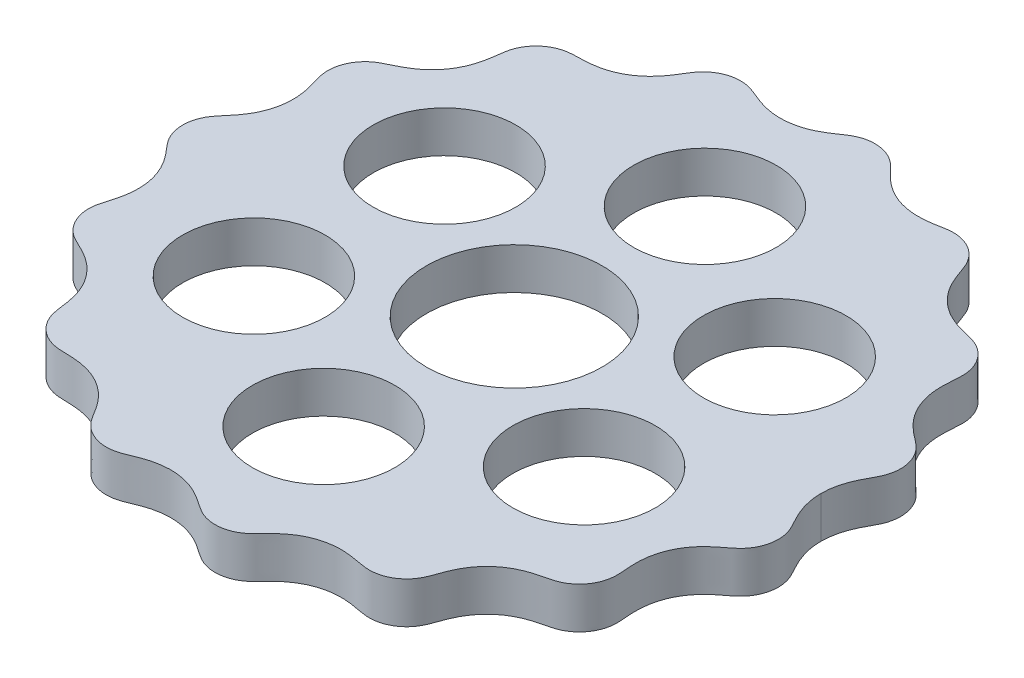
from build123d import *

# Parameters (mm, degrees)
SKETCH1_R           = 10.6
SKETCH1_R_2         = 8.6
BOSS_EXTRUDE1_DEPTH = 5


with BuildPart() as part:
    # Sketch1 → Boss-Extrude1 (new body)
    with BuildSketch(Plane(origin=(0, 0, 0), x_dir=(1, 0, 0), z_dir=(0, 1, 0))):
        with BuildLine():
            add(Edge.make_bspline(
                [(37, 0), (37, -0.03143727), (37.000453604, -0.094999987), (37.002494823, -0.209960319), (37.007935699, -0.365962041), (37.018130067, -0.547435978), (37.035778539, -0.762613663), (37.062295011, -1.000704503), (37.099596576, -1.254145629), (37.141666769, -1.490121949), (37.186730566, -1.707704996), (37.27599878, -2.086217996), (37.432607644, -2.61967024), (37.650272858, -3.191702622), (37.93344139, -3.795551093), (38.205952219, -4.315706499), (38.450459887, -4.76062227), (38.70692772, -5.235202277), (38.941768984, -5.756697541), (39.137855891, -6.378800099), (39.247955338, -7.103857197), (39.228570469, -7.939956238), (39.019285386, -8.855824089), (38.577559758, -9.823505319), (37.820964583, -10.754370622), (36.848063751, -11.434964366), (35.925475538, -12.170726431), (35.15516003, -12.931370117), (34.54379505, -13.69507461), (33.895237033, -14.741994379), (33.428420876, -15.89037885), (33.16127245, -17.104145416), (33.090755906, -18.276711654), (33.117928675, -19.134785899), (33.184630754, -19.922725011), (33.242632466, -20.644624385), (33.219628568, -21.437875666), (33.036316371, -22.28173929), (32.662226146, -23.128482681), (32.07870968, -23.926433825), (31.270520944, -24.647504284), (30.212930356, -25.19576041), (29.05618735, -25.42594367), (27.921165014, -25.714783041), (26.912865036, -26.088040866), (26.04670806, -26.526543792), (25.231490798, -27.070153578), (24.486296273, -27.71622491), (23.823206933, -28.456781999), (23.254813288, -29.28043732), (22.819009974, -30.105428972), (22.489240246, -30.904456359), (22.226168392, -31.656017359), (21.986325362, -32.344433223), (21.645702747, -33.067171886), (21.136896315, -33.772149992), (20.444596547, -34.405183963), (19.573466113, -34.908137767), (18.679093954, -35.191155105), (17.814153371, -35.279328837), (17.017950382, -35.212908103), (16.301803877, -35.076487108), (15.519474027, -34.928387551), (14.662477813, -34.814713427), (13.480415131, -34.769744424), (12.24114903, -34.919564924), (11.051981736, -35.275534422), (9.949378286, -35.820248955), (9.136432454, -36.351322247), (8.309098279, -37.037782148), (7.491403014, -37.876399023), (6.713712112, -38.763029071), (5.710099738, -39.404826424), (4.681547406, -39.744189192), (3.698738629, -39.8505626), (2.778395229, -39.751156366), (1.955929975, -39.487981912), (1.257453316, -39.111274685), (0.66127052, -38.700097997), (0.012246131, -38.248357139), (-0.717280827, -37.795796162), (-1.768012922, -37.270567489), (-2.952736789, -36.895066329), (-4.18067966, -36.725111536), (-5.411611299, -36.763370496), (-6.378691755, -36.910893684), (-7.422567545, -37.197831253), (-8.521082833, -37.628680279), (-9.596894828, -38.131330913), (-10.781414036, -38.320591212), (-11.865254321, -38.217684033), (-12.80999509, -37.9179101), (-13.765403055, -37.370059654), (-14.639711952, -36.510029042), (-15.224959632, -35.447056134), (-15.875186541, -34.432134448), (-16.722685045, -33.381987434), (-17.645169147, -32.549366783), (-18.695344862, -31.881164302), (-19.839308599, -31.40312617), (-20.793085274, -31.134677942), (-21.881721133, -30.964500418), (-23.08542905, -30.908652495), (-24.29883225, -30.933417715), (-25.48067958, -30.606197148), (-26.432898172, -30.052748184), (-27.164845045, -29.384446693), (-27.795906987, -28.497278622), (-28.22424747, -27.376816763), (-28.326856093, -26.193816745), (-28.502980453, -25.027046282), (-28.77642721, -23.979556749), (-29.132206305, -23.068277652), (-29.714540354, -21.983130932), (-30.47569585, -21.004677931), (-31.393252135, -20.166428114), (-32.373478982, -19.519081264), (-33.130172271, -19.113573458), (-33.84590289, -18.777371391), (-34.500084654, -18.46665169), (-35.175559662, -18.050104617), (-35.814710148, -17.469419425), (-36.360966849, -16.722076386), (-36.760254169, -15.817760446), (-36.980625548, -14.757313596), (-36.926633396, -13.567284637), (-36.547607451, -12.450425228), (-36.230236904, -11.323045641), (-36.049340213, -10.263206081), (-35.996011997, -9.293835892), (-36.059190915, -8.316040479), (-36.246094895, -7.347633334), (-36.555913141, -6.403126163), (-36.984986238, -5.49901541), (-37.4816085, -4.709168384), (-38.008605013, -4.023960492), (-38.528096971, -3.420524046), (-39.004092361, -2.868313104), (-39.352986229, -2.366627777), (-39.578197628, -1.930892754), (-39.717578718, -1.588781599), (-39.798314559, -1.352462416), (-39.865873622, -1.112280963), (-39.913167386, -0.899005121), (-39.945298995, -0.714032442), (-39.966442184, -0.560824819), (-39.979976403, -0.438104209), (-39.99012853, -0.31081675), (-39.99689741, -0.175935477), (-39.999435894, -0.081206791), (-40, -0.026915074), (-40, -1e-09)],
                knots=[0.06614426, 0.06614426, 0.06614426, 0.06614426, 0.06614426, 0.067102742, 0.068061224, 0.069019706, 0.069978188, 0.071895152, 0.073812116, 0.075273751, 0.076735387, 0.078197023, 0.079658659, 0.085505202, 0.091351745, 0.094275016, 0.097198288, 0.100954467, 0.104710646, 0.108466825, 0.112223004, 0.118069589, 0.123916173, 0.130338535, 0.136760898, 0.145879075, 0.154997253, 0.161421442, 0.167845631, 0.17426982, 0.18069401, 0.193736695, 0.200258038, 0.206779381, 0.211541823, 0.216304265, 0.221066707, 0.225829148, 0.232348859, 0.238868571, 0.245245472, 0.251622373, 0.260676895, 0.269731417, 0.276109562, 0.282487707, 0.288865852, 0.295243997, 0.301811097, 0.308378198, 0.314945298, 0.321512399, 0.326307116, 0.331101834, 0.335896552, 0.340691269, 0.347256117, 0.353820965, 0.360385813, 0.366950661, 0.371745379, 0.376540096, 0.381334814, 0.386129532, 0.392696632, 0.399263733, 0.412397934, 0.418776079, 0.425154223, 0.431532368, 0.437910513, 0.446965035, 0.456019557, 0.462396459, 0.46877336, 0.475293071, 0.481812782, 0.486575224, 0.491337666, 0.496100107, 0.500862549, 0.507383892, 0.513905235, 0.526947921, 0.53337211, 0.539796299, 0.546220489, 0.552644678, 0.561762855, 0.570881032, 0.577303395, 0.583725757, 0.590229974, 0.596734191, 0.606102622, 0.615471053, 0.621977695, 0.628484337, 0.641497621, 0.648004263, 0.654510905, 0.661017547, 0.667524189, 0.67689262, 0.686261051, 0.692765268, 0.699269485, 0.705691847, 0.71211421, 0.721232387, 0.730350565, 0.736774754, 0.743198943, 0.749623132, 0.756047322, 0.769090007, 0.77561135, 0.782132693, 0.786895135, 0.791657577, 0.796420019, 0.80118246, 0.807702171, 0.814221883, 0.820598784, 0.826975685, 0.836030207, 0.845084729, 0.851462874, 0.857841019, 0.864219164, 0.870597309, 0.877164409, 0.88373151, 0.89029861, 0.896865711, 0.901660428, 0.906455146, 0.911249864, 0.916044581, 0.917685793, 0.919327005, 0.920968217, 0.922609429, 0.924250641, 0.925071247, 0.925891853, 0.926712459, 0.927533065, 0.928353671, 0.929174277, 0.929174277, 0.929174277, 0.929174277, 0.929174277], degree=4))
            add(Edge.make_bspline(
                [(-40, -1e-09), (-40, 0.026915073), (-39.999435898, 0.081102132), (-39.996897439, 0.173969707), (-39.990128591, 0.308512197), (-39.979976315, 0.43784111), (-39.96644193, 0.561596862), (-39.949527385, 0.683811751), (-39.92923545, 0.806418669), (-39.905569953, 0.929082564), (-39.878536112, 1.05108509), (-39.840542165, 1.202393225), (-39.788245672, 1.382030281), (-39.717511124, 1.588706673), (-39.612678592, 1.8465975), (-39.4787487, 2.123083835), (-39.310663945, 2.414096923), (-39.104945299, 2.715281305), (-38.881313352, 3.003243592), (-38.647115103, 3.282501031), (-38.34984736, 3.627713203), (-37.95291863, 4.096180366), (-37.481683121, 4.709256859), (-36.984926096, 5.498908372), (-36.555971315, 6.403267497), (-36.170215472, 7.578337946), (-35.9868127, 8.798814705), (-36.009059108, 10.024440425), (-36.200622014, 11.152023378), (-36.408520549, 11.955019807), (-36.630718407, 12.680349542), (-36.821563566, 13.341696839), (-36.992348492, 14.33180594), (-36.904909082, 15.422182159), (-36.504382838, 16.524262833), (-35.814997617, 17.469697467), (-35.175412137, 18.050006312), (-34.5001255, 18.466591368), (-33.84600501, 18.777687977), (-32.905560624, 19.218134843), (-31.725163504, 19.887218348), (-30.439584969, 20.966645125), (-29.285197967, 22.586057403), (-28.686625036, 24.137217697), (-28.434119871, 25.439027518), (-28.31164158, 26.439459997), (-28.21864172, 27.126579635), (-28.036118522, 27.870890122), (-27.694662989, 28.638492196), (-27.164686183, 29.384972568), (-26.433444718, 30.052566346), (-25.634630631, 30.516068805), (-24.823088132, 30.788827784), (-24.04685872, 30.899230803), (-23.334712945, 30.920266621), (-22.306444557, 30.937751057), (-20.963494482, 31.058617768), (-19.344902311, 31.506985138), (-17.613398371, 32.506669405), (-16.415804752, 33.684227657), (-15.639656073, 34.786823183), (-15.110379913, 35.668587511), (-14.736089473, 36.274805934), (-14.252362947, 36.891838815), (-13.610375494, 37.458275746), (-12.809563546, 37.918317809), (-11.865789642, 38.217794604), (-10.954330273, 38.303527797), (-10.118839611, 38.215435923), (-9.382986221, 38.00135041), (-8.741423229, 37.738330824), (-7.813784142, 37.344183911), (-6.560131184, 36.91195486), (-4.917500499, 36.654754125), (-2.937854825, 36.844776382), (-1.360254549, 37.418406773), (-0.190612674, 38.106118753), (0.66104769, 38.700344294), (1.25752551, 39.11128049), (1.955942055, 39.487804143), (2.778297019, 39.751545742), (3.94176, 39.875855803), (5.096453052, 39.671677477), (6.084466159, 39.202219931), (6.856533473, 38.559253291), (7.333854157, 38.063319478), (7.850909823, 37.508190885), (8.442374814, 36.92670684), (9.323110596, 36.196912537), (10.58841665, 35.435636692), (11.999200644, 34.94870835), (13.48033229, 34.769799778), (14.662523081, 34.814686453), (15.519442707, 34.928402455), (16.301826743, 35.076481327), (17.01792965, 35.21290787), (17.814178726, 35.27933238), (18.679056308, 35.191146999), (19.573524947, 34.908152618), (20.444504658, 34.405159426), (21.137044029, 33.772190195), (21.591803381, 33.141505578), (21.869639533, 32.592625152), (22.075891139, 32.086193752), (22.226561366, 31.656080042), (22.376591176, 31.226097871), (22.593668003, 30.651444897), (22.86151291, 30.024879345), (23.255100485, 29.280174836), (23.822818619, 28.457094584), (24.649069231, 27.534594711), (25.802527601, 26.61516732), (27.218058872, 25.905303721), (28.817567995, 25.472660001), (30.452832349, 25.14875342), (31.698805724, 24.383263182), (32.56091801, 23.351770837), (33.037621539, 22.281751264), (33.218869869, 21.437861265), (33.242984107, 20.64464847), (33.184772246, 19.922675951), (33.096291135, 18.887971334), (33.085336205, 17.531197285), (33.377495648, 15.878125019), (34.202660288, 14.068701252), (35.246780487, 12.774733869), (36.247889348, 11.905159004), (37.053074749, 11.298868113), (37.601617193, 10.874775338), (38.154972669, 10.344538529), (38.64897071, 9.665047684), (39.030511654, 8.832802317), (39.242952499, 7.865782472), (39.245093638, 6.94215806), (39.075312522, 6.10308858), (38.783182879, 5.375443563), (38.444617083, 4.748588598), (38.126578469, 4.173031944), (37.854861766, 3.633998474), (37.633034591, 3.131674523), (37.47857496, 2.727184292), (37.362612428, 2.374730281), (37.2774171, 2.077549654), (37.216377239, 1.837879163), (37.162604445, 1.596443845), (37.116253691, 1.353582746), (37.077446812, 1.109379842), (37.050179424, 0.893728529), (37.031634183, 0.710857807), (37.019415923, 0.558351339), (37.011589025, 0.433066649), (37.00424606, 0.269586224), (37.00097986, 0.133534053), (37, 0.053352873), (37, 0)],
                knots=[0.070825729, 0.070825729, 0.070825729, 0.070825729, 0.070825729, 0.071646335, 0.072466941, 0.073287547, 0.074108153, 0.074928759, 0.075749365, 0.076569971, 0.077390577, 0.078211183, 0.079031789, 0.080673002, 0.082314214, 0.083955426, 0.086352785, 0.088750144, 0.091147503, 0.093544862, 0.095942221, 0.09833958, 0.103134298, 0.109701399, 0.1162685, 0.122835601, 0.129402703, 0.142158993, 0.148537139, 0.154915284, 0.159442546, 0.163969807, 0.168497068, 0.17302433, 0.185778133, 0.192297845, 0.198817557, 0.203579999, 0.208342441, 0.213104883, 0.217867326, 0.230910013, 0.243952699, 0.256801079, 0.269649459, 0.274208548, 0.278767637, 0.283326726, 0.287885815, 0.294308178, 0.300730541, 0.307234758, 0.313738976, 0.318423192, 0.323107408, 0.327791624, 0.33247584, 0.345489125, 0.35850241, 0.371515695, 0.38452898, 0.389213196, 0.393897412, 0.398581628, 0.403265844, 0.409770061, 0.416274278, 0.422696641, 0.429119005, 0.433678094, 0.438237183, 0.442796272, 0.447355361, 0.46020374, 0.47305212, 0.486094807, 0.499137494, 0.503899936, 0.508662378, 0.51342482, 0.518187263, 0.524706974, 0.531226686, 0.54398049, 0.548507751, 0.553035012, 0.557562274, 0.562089535, 0.568467681, 0.574845826, 0.587602117, 0.600736319, 0.60730342, 0.613870521, 0.618665239, 0.623459957, 0.628254676, 0.633049394, 0.639614242, 0.64617909, 0.652743939, 0.659308787, 0.664103505, 0.666500865, 0.668898224, 0.673692942, 0.676090301, 0.67848766, 0.685054761, 0.691621862, 0.698188963, 0.704756064, 0.717512355, 0.730268646, 0.739323169, 0.748377691, 0.761131495, 0.767651207, 0.774170918, 0.778933361, 0.783695803, 0.788458245, 0.793220687, 0.806263374, 0.819306061, 0.832154441, 0.84500282, 0.849561909, 0.854120998, 0.858680087, 0.863239176, 0.869661539, 0.876083903, 0.88258812, 0.889092337, 0.893776553, 0.898460769, 0.903144985, 0.907829201, 0.911082522, 0.914335844, 0.917589165, 0.919215826, 0.920842486, 0.922469147, 0.924095807, 0.925722468, 0.927349129, 0.928975789, 0.92978912, 0.93060245, 0.93141578, 0.932229111, 0.933855771, 0.933855771, 0.933855771, 0.933855771, 0.933855771], degree=4))
        make_face()
        Circle(SKETCH1_R, mode=Mode.SUBTRACT)
        with Locations((0, 23)):
            Circle(SKETCH1_R_2, mode=Mode.SUBTRACT)
        with Locations((19.918584287, 11.5)):
            Circle(SKETCH1_R_2, mode=Mode.SUBTRACT)
        with Locations((19.918584287, -11.5)):
            Circle(SKETCH1_R_2, mode=Mode.SUBTRACT)
        with Locations((0, -23)):
            Circle(SKETCH1_R_2, mode=Mode.SUBTRACT)
        with Locations((-19.918584287, -11.5)):
            Circle(SKETCH1_R_2, mode=Mode.SUBTRACT)
        with Locations((-19.918584287, 11.5)):
            Circle(SKETCH1_R_2, mode=Mode.SUBTRACT)
    extrude(amount=BOSS_EXTRUDE1_DEPTH)


solid = part.part
